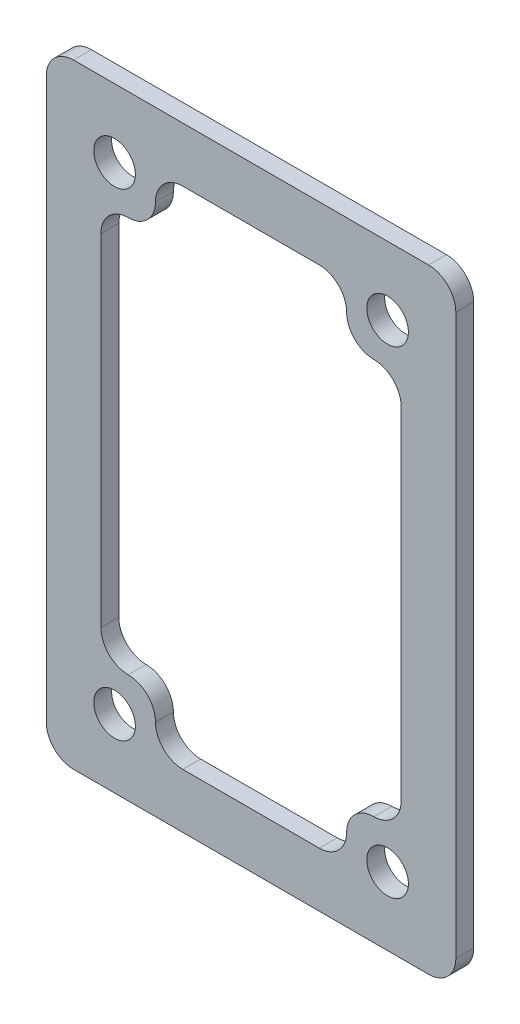
from build123d import *

# Parameters (mm, degrees)
SKETCH_1_W          = 30
SKETCH_1_H          = 45
EXTRUDE_1_DEPTH     = 1.31
SKETCH_2_R          = 1.525
CUT_EXTRUDE_1_DEPTH = 10
SKETCH_3_W          = 14
SKETCH_3_H          = 37
CUT_EXTRUDE_2_DEPTH = 10
SKETCH_4_W          = 22
SKETCH_4_H          = 29
CUT_EXTRUDE_3_DEPTH = 10
FILLET_1_R          = 2
FILLET_2_R          = 2


with BuildPart() as part:
    # 草图1 → 凸台-拉伸1 (new body)
    with BuildSketch(Plane.XY):
        Rectangle(SKETCH_1_W, SKETCH_1_H)
    extrude(amount=EXTRUDE_1_DEPTH)

    # 草图2 → 切除-拉伸1 (cut)
    with BuildSketch(Plane.XY.offset(1.31)):
        with Locations((-10, 17.5)):
            Circle(SKETCH_2_R)
        with Locations((10, 17.5)):
            Circle(SKETCH_2_R)
        with Locations((-10, -17.5)):
            Circle(SKETCH_2_R)
        with Locations((10, -17.5)):
            Circle(SKETCH_2_R)
    extrude(amount=-CUT_EXTRUDE_1_DEPTH, mode=Mode.SUBTRACT)

    # 草图3 → 切除-拉伸2 (cut)
    with BuildSketch(Plane.XY.offset(1.31)):
        Rectangle(SKETCH_3_W, SKETCH_3_H)
    extrude(amount=-CUT_EXTRUDE_2_DEPTH, mode=Mode.SUBTRACT)

    # 草图4 → 切除-拉伸3 (cut)
    with BuildSketch(Plane.XY.offset(1.31)):
        Rectangle(SKETCH_4_W, SKETCH_4_H)
    extrude(amount=-CUT_EXTRUDE_3_DEPTH, mode=Mode.SUBTRACT)

    # 圆角1
    fillet_1_edges = [part.edges().sort_by_distance(p)[0] for p in [
        (-7, -18.5, 0.655),
        (11, -14.5, 0.655),
        (11, 14.5, 0.655),
        (7, 14.5, 0.655),
        (7, 18.5, 0.655),
        (-7, 18.5, 0.655),
        (-7, 14.5, 0.655),
        (-11, 14.5, 0.655),
        (-11, -14.5, 0.655),
        (-7, -14.5, 0.655),
        (7, -14.5, 0.655),
        (7, -18.5, 0.655),
    ]]
    fillet(fillet_1_edges, radius=FILLET_1_R - 0.0001)  # a hair under: the kernel refuses the full size

    # 圆角2
    fillet_2_edges = [part.edges().sort_by_distance(p)[0] for p in [
        (15, -22.5, 0.655),
        (-15, -22.5, 0.655),
        (-15, 22.5, 0.655),
        (15, 22.5, 0.655),
    ]]
    fillet(fillet_2_edges, radius=FILLET_2_R)


solid = part.part
